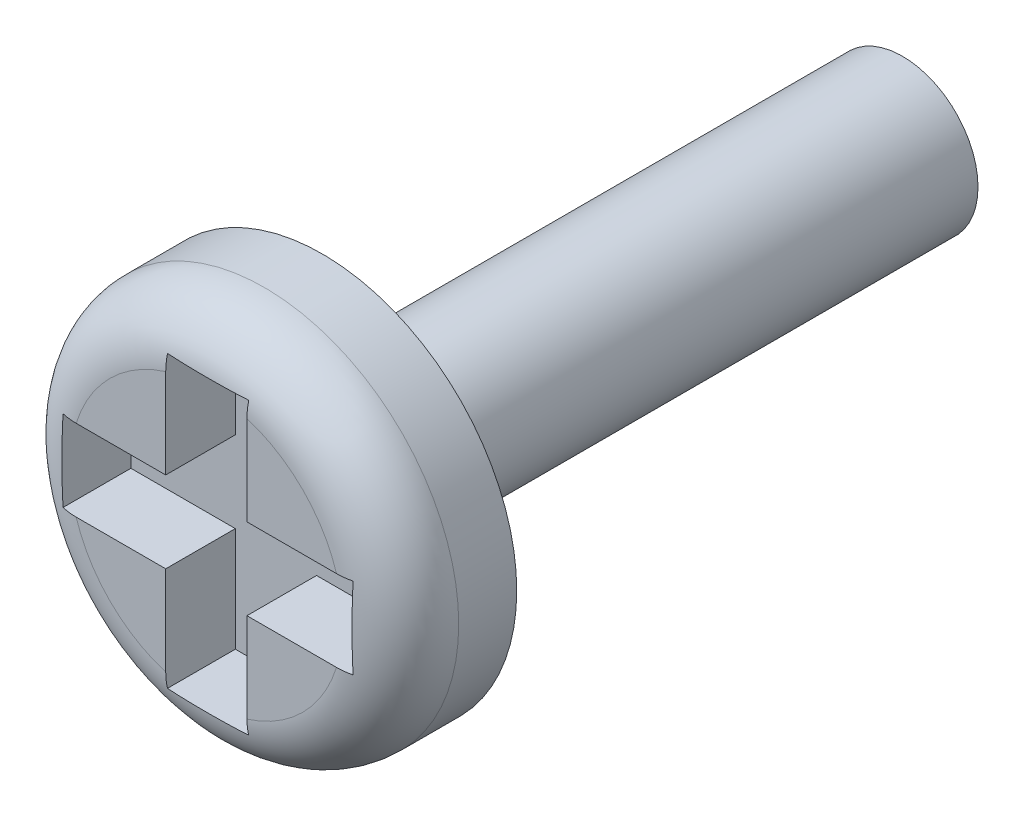
from build123d import *

# Parameters (mm, degrees)
CROQUIS1_R              = 0.65
SALIENTE_EXTRUIR1_DEPTH = 5
CROQUIS2_R              = 1.675
SALIENTE_EXTRUIR2_DEPTH = 1
CORTAR_EXTRUIR1_DEPTH   = 0.6
REDONDEO1_R             = 0.5


with BuildPart() as part:
    # Croquis1 → Saliente-Extruir1 (new body)
    with BuildSketch(Plane.XY):
        Circle(CROQUIS1_R)
    extrude(amount=SALIENTE_EXTRUIR1_DEPTH)

    # Croquis2 → Saliente-Extruir2 (add)
    with BuildSketch(Plane.XY.offset(5)):
        Circle(CROQUIS2_R)
    extrude(amount=SALIENTE_EXTRUIR2_DEPTH)

    # Croquis3 → Cortar-Extruir1 (cut)
    with BuildSketch(Plane.XY.offset(6)):
        Polygon((0.35, 0.35), (1.25, 0.35), (1.25, -0.35), (0.35, -0.35), (0.35, -1.25), (-0.35, -1.25), (-0.35, -0.35), (-1.25, -0.35), (-1.25, 0.35), (-0.35, 0.35), (-0.35, 1.25), (0.35, 1.25), align=None)
    extrude(amount=-CORTAR_EXTRUIR1_DEPTH, mode=Mode.SUBTRACT)

    # Redondeo1
    # the kernel refuses this fillet: 0.5 mm, written as the material it takes off along each edge
    with BuildSketch(Plane(origin=(0, 0, 6), x_dir=(1, 0, 0), z_dir=(0, -1, 0))) as redondeo1_piece_1:
        with BuildLine():
            CenterArc((1.675 - REDONDEO1_R, -REDONDEO1_R), REDONDEO1_R, 0, 90)
            Line((1.675 - REDONDEO1_R, 0), (1.675, 0))
            Line((1.675, 0), (1.675, -REDONDEO1_R))
        make_face()
    revolve(axis=Axis((0, 0, 6), (0, 0, 1)), mode=Mode.SUBTRACT)


solid = part.part
